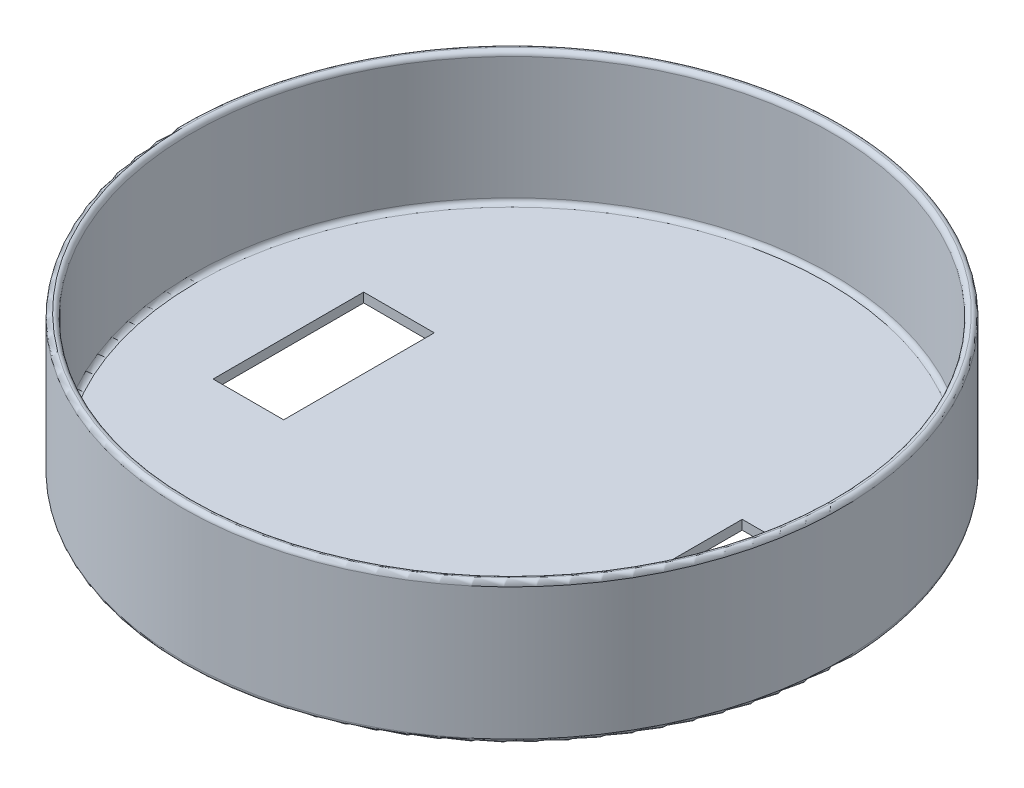
from build123d import *

# Parameters (mm, degrees)
CROQUIS1_R              = 35
SALIENTE_EXTRUIR1_DEPTH = 15
CROQUIS2_R              = 34
CORTAR_EXTRUIR1_DEPTH   = 14
REDONDEO1_R             = 0.5
REDONDEO5_R             = 0.5
CORTAR_EXTRUIR2_REACH   = 53.72
CROQUIS3_W              = 5.5
CROQUIS3_H              = 14.4
CROQUIS3_W_2            = 7.5
CROQUIS3_H_2            = 16


with BuildPart() as part:
    # Croquis1 → Saliente-Extruir1 (new body)
    with BuildSketch(Plane(origin=(0, 0, 0), x_dir=(1, 0, 0), z_dir=(0, 1, 0))):
        with Locations(Location((0, 0, 0), (0, 0, 270))):
            Circle(CROQUIS1_R)
    extrude(amount=SALIENTE_EXTRUIR1_DEPTH)

    # Croquis2 → Cortar-Extruir1 (cut)
    with BuildSketch(Plane(origin=(0, 15, 0), x_dir=(1, 0, 0), z_dir=(0, 1, 0))):
        with Locations(Location((0, 0, 0), (0, 0, 270))):
            Circle(CROQUIS2_R)
    extrude(amount=-CORTAR_EXTRUIR1_DEPTH, mode=Mode.SUBTRACT)

    # Redondeo1
    redondeo1_edges = [part.edges().sort_by_distance(p)[0] for p in [
        (0, 0, -35),
    ]]
    fillet(redondeo1_edges, radius=REDONDEO1_R)

    # Redondeo5
    redondeo5_edges = [part.edges().sort_by_distance(p)[0] for p in [
        (0, 15, -35),
        (0, 15, -34),
        (0, 1, -34),
    ]]
    fillet(redondeo5_edges, radius=REDONDEO5_R - 0.0001)  # a hair under: the kernel refuses the full size

    # Croquis3 → Cortar-Extruir2 (cut, up to next)
    with BuildSketch(Plane.XZ, mode=Mode.PRIVATE) as cortar_extruir2_sk1:
        with Locations((20, 0)):
            Rectangle(CROQUIS3_W, CROQUIS3_H)
    cortar_extruir2_tool1 = extrude(cortar_extruir2_sk1.sketch, amount=-CORTAR_EXTRUIR2_REACH, mode=Mode.PRIVATE) & part.part
    # Croquis3 → Cortar-Extruir2 (cut, up to next)
    with BuildSketch(Plane.XZ, mode=Mode.PRIVATE) as cortar_extruir2_sk2:
        with Locations((-20, 0)):
            Rectangle(CROQUIS3_W_2, CROQUIS3_H_2)
    cortar_extruir2_tool2 = extrude(cortar_extruir2_sk2.sketch, amount=-CORTAR_EXTRUIR2_REACH, mode=Mode.PRIVATE) & part.part
    add(cortar_extruir2_tool1.solids().sort_by_distance((20, 0, 0))[0], mode=Mode.SUBTRACT)
    add(cortar_extruir2_tool2.solids().sort_by_distance((-20, 0, 0))[0], mode=Mode.SUBTRACT)


solid = part.part
